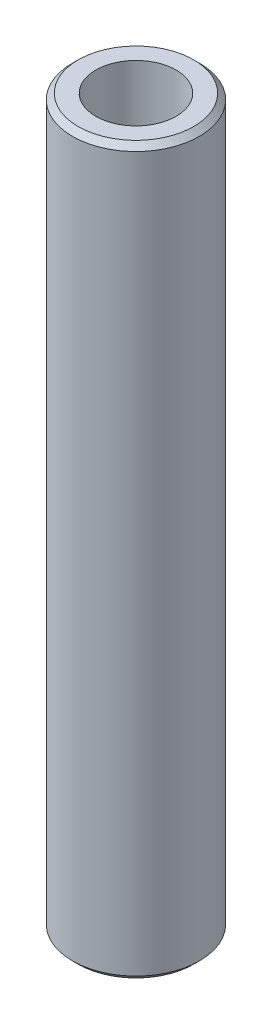
from build123d import *

# Parameters (mm, degrees)
SKETCH1_R           = 52.5
BOSS_EXTRUDE1_DEPTH = 600
SKETCH2_R           = 33.212643416
CUT_EXTRUDE1_DEPTH  = 605.576297914
CHAMFER1_SIZE       = 4.69902253


with BuildPart() as part:
    # Sketch1 → Boss-Extrude1 (new body)
    with BuildSketch(Plane(origin=(0, 0, 0), x_dir=(1, 0, 0), z_dir=(0, 1, 0))):
        Circle(SKETCH1_R)
    extrude(amount=BOSS_EXTRUDE1_DEPTH)

    # Sketch2 → Cut-Extrude1 (cut, through all)
    with BuildSketch(Plane(origin=(0, 0, 0), x_dir=(1, 0, 0), z_dir=(0, 1, 0))):
        Circle(SKETCH2_R)
    extrude(amount=CUT_EXTRUDE1_DEPTH, mode=Mode.SUBTRACT)

    # Chamfer1
    chamfer1_edges = [part.edges().sort_by_distance(p)[0] for p in [
        (-52.5, 600, 0),
        (-52.5, 0, 0),
    ]]
    chamfer(chamfer1_edges, length=CHAMFER1_SIZE)


solid = part.part
